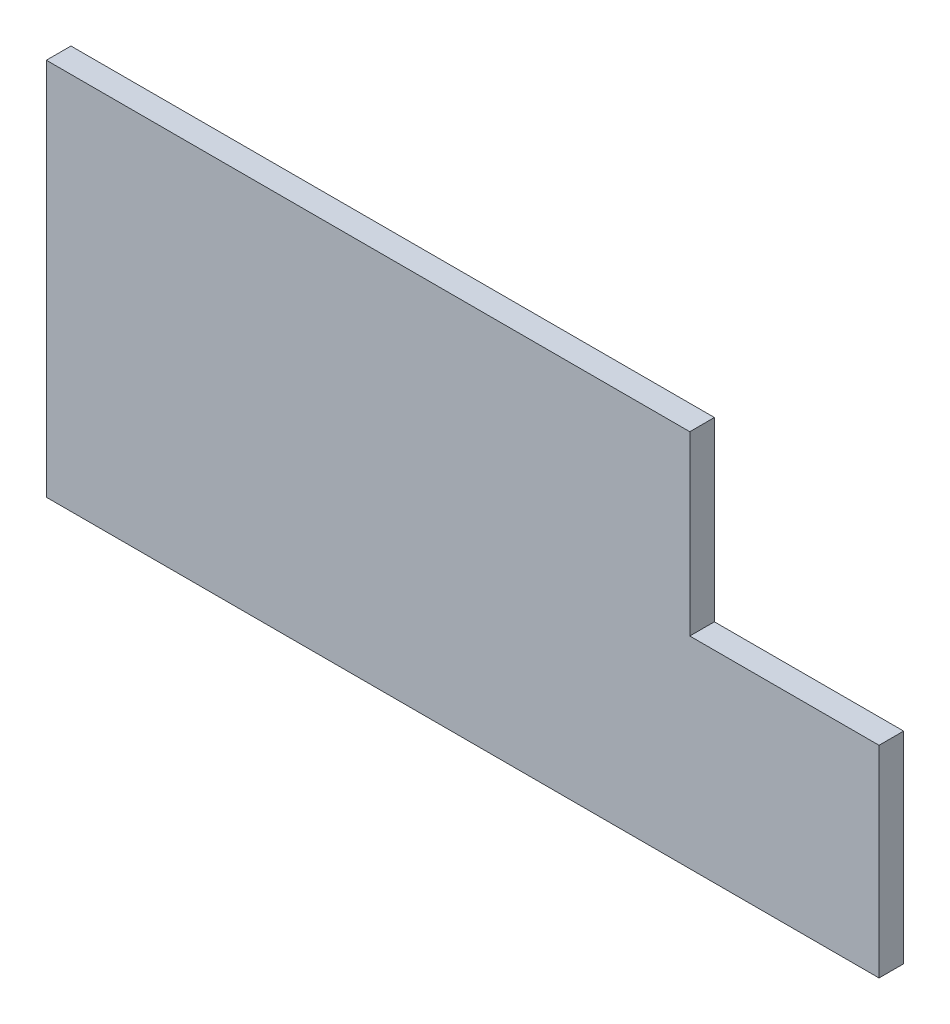
from build123d import *

# Parameters (mm, degrees)
ESQUISSE1_W        = 170
ESQUISSE1_H        = 100
BOSS_EXTRU_1_DEPTH = 6.5
ESQUISSE2_W        = 6.5
ESQUISSE2_H        = 53.25
BOSS_EXTRU_2_DEPTH = 50


with BuildPart() as part:
    # Esquisse1 → Boss.-Extru.1 (new body)
    with BuildSketch(Plane.XY):
        with Locations((-18.588292944, -1.358695652)):
            Rectangle(ESQUISSE1_W, ESQUISSE1_H)
    extrude(amount=BOSS_EXTRU_1_DEPTH)

    # Esquisse2 → Boss.-Extru.2 (add)
    with BuildSketch(Plane(origin=(66.411707056, 0, 0), x_dir=(0, 0, -1), z_dir=(1, 0, 0))):
        with Locations((-3.25, -24.733695652)):
            Rectangle(ESQUISSE2_W, ESQUISSE2_H)
    extrude(amount=BOSS_EXTRU_2_DEPTH)


solid = part.part
